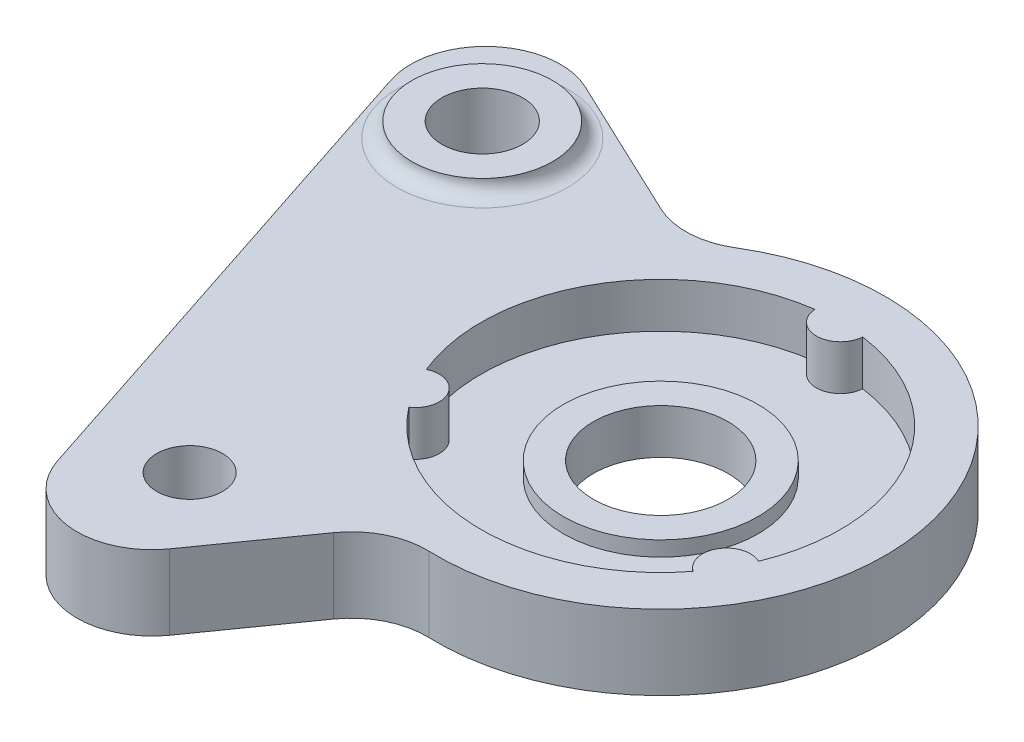
from build123d import *

# Parameters (mm, degrees)
SKETCH2_R           = 12
SKETCH2_R_2         = 2.2
SKETCH2_R_3         = 2.7
BOSS_EXTRUDE1_DEPTH = 5
SKETCH2_4_R         = 4.5
BOSS_EXTRUDE2_DEPTH = 2
FILLET1_R           = 5
FILLET2_R           = 5
SKETCH3_R           = 4.7
SKETCH3_R_2         = 2.7
BOSS_EXTRUDE3_DEPTH = 1
FILLET4_R           = 1
SKETCH4_R           = 6.5
SKETCH4_R_2         = 4.5
BOSS_EXTRUDE5_DEPTH = 1
BOSS_EXTRUDE6_DEPTH = 3


with BuildPart() as part:
    # Sketch2 → Boss-Extrude1 (new body)
    with BuildSketch(Plane(origin=(0, 0, 0), x_dir=(1, 0, 0), z_dir=(0, 1, 0))):
        with BuildLine():
            Line((-32.658907628, 22.065310299), (-15.027926619, -31.62041432))
            Line((-15.027926619, -31.62041432), (-3.044319626, -14.687822099))
            ThreePointArc((-3.044319626, -14.687822099), (14.508216797, 3.809415358), (-9.86730521, 11.297623108))
            Line((-9.86730521, 11.297623108), (-32.658907628, 22.065310299))
        make_face()
        with Locations(Location((0, 0, 0), (0, 0, 270))):
            Circle(SKETCH2_R, mode=Mode.SUBTRACT)
        with Locations(Location((-13.044155697, -18.431125905, 0), (0, 0, 270))):
            Circle(SKETCH2_R_2, mode=Mode.SUBTRACT)
        with Locations(Location((-22.604306415, 10.679200882, 0), (0, 0, 270))):
            Circle(SKETCH2_R_3, mode=Mode.SUBTRACT)
    extrude(amount=BOSS_EXTRUDE1_DEPTH)

    # Sketch2<4> → Boss-Extrude2 (add)
    # profile 1 of 2: a face of its own
    with BuildSketch(Plane(origin=(0, 0, 0), x_dir=(1, 0, 0), z_dir=(0, 1, 0))):
        with BuildLine():
            Line((9.028311423, 2.370559296), (-1.105938309, -11.948928841))
            ThreePointArc((-1.105938309, -11.948928841), (8.084823445, -8.867673306), (12, 0))
            ThreePointArc((12, 0), (5.567714695, 10.630171827), (-6.833425512, 9.864293983))
            Line((-6.833425512, 9.864293983), (9.028311423, 2.370559296))
        make_face()
    # profile 2 of 2: a face of its own
    with BuildSketch(Plane(origin=(0, 0, 0), x_dir=(1, 0, 0), z_dir=(0, 1, 0))):
        with BuildLine():
            ThreePointArc((-6.833425512, 9.864293983), (-11.606573438, -3.047532287), (-1.105938309, -11.948928841))
            Line((-1.105938309, -11.948928841), (9.028311423, 2.370559296))
            Line((9.028311423, 2.370559296), (-6.833425512, 9.864293983))
        make_face()
        with Locations(Location((0, 0, 0), (0, 0, 270))):
            Circle(SKETCH2_4_R, mode=Mode.SUBTRACT)
    extrude(amount=BOSS_EXTRUDE2_DEPTH)

    # Fillet1
    fillet1_edges = [part.edges().sort_by_distance(p)[0] for p in [
        (-15.027926619, 2.5, 31.62041432),
        (-32.658907628, 2.5, -22.065310299),
    ]]
    fillet(fillet1_edges, radius=FILLET1_R)

    # Fillet2
    fillet2_edges = [part.edges().sort_by_distance(p)[0] for p in [
        (-9.86730521, 2.5, -11.297623108),
        (-3.044319626, 2.5, 14.687822099),
    ]]
    fillet(fillet2_edges, radius=FILLET2_R)

    # Sketch3 → Boss-Extrude3 (add)
    with BuildSketch(Plane(origin=(0, 5, 0), x_dir=(1, 0, 0), z_dir=(0, 1, 0))):
        with Locations(Location((-22.604306415, 10.679200882, 0), (0, 0, 270))):
            Circle(SKETCH3_R)
        with Locations(Location((-22.604306415, 10.679200882, 0), (0, 0, 270))):
            Circle(SKETCH3_R_2, mode=Mode.SUBTRACT)
    extrude(amount=BOSS_EXTRUDE3_DEPTH)

    # Fillet4
    fillet4_edges = [part.edges().sort_by_distance(p)[0] for p in [
        (-22.604306415, 5, -15.379200882),
    ]]
    fillet(fillet4_edges, radius=FILLET4_R - 0.0001)  # a hair under: the kernel refuses the full size

    # Sketch4 → Boss-Extrude5 (add)
    with BuildSketch(Plane(origin=(0, 2, 0), x_dir=(1, 0, 0), z_dir=(0, 1, 0))):
        with Locations(Location((0, 0, 0), (0, 0, 270))):
            Circle(SKETCH4_R)
        with Locations(Location((0, 0, 0), (0, 0, 270))):
            Circle(SKETCH4_R_2, mode=Mode.SUBTRACT)
    extrude(amount=BOSS_EXTRUDE5_DEPTH)

    # Sketch4<4> → Boss-Extrude6 (add)
    with BuildSketch(Plane(origin=(0, 2, 0), x_dir=(1, 0, 0), z_dir=(0, 1, 0))):
        with BuildLine():
            ThreePointArc((1.596440485, 11.893333333), (0, 12), (-1.596440485, 11.893333333))
            ThreePointArc((-1.596440485, 11.893333333), (0, 10.4), (1.596440485, 11.893333333))
        make_face()
        with BuildLine():
            ThreePointArc((9.50170856, -7.329224682), (10.392304845, -6), (11.098149045, -4.564108651))
            ThreePointArc((11.098149045, -4.564108651), (9.006664199, -5.2), (9.50170856, -7.329224682))
        make_face()
        with BuildLine():
            ThreePointArc((-9.50170856, -7.329224682), (-9.006664199, -5.2), (-11.098149045, -4.564108651))
            ThreePointArc((-11.098149045, -4.564108651), (-10.392304845, -6), (-9.50170856, -7.329224682))
        make_face()
    extrude(amount=BOSS_EXTRUDE6_DEPTH)


solid = part.part
